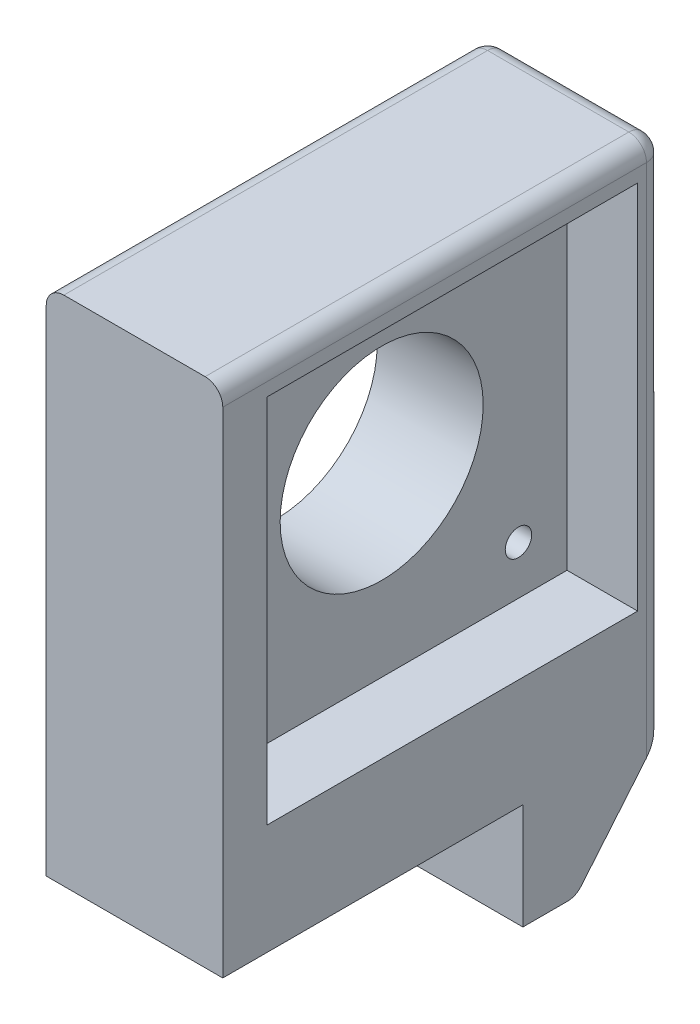
from build123d import *

# Parameters (mm, degrees)
SKETCH1_W           = 20
SKETCH1_H           = 50
BOSS_EXTRUDE1_DEPTH = 70
SKETCH2_R           = 1.5
SKETCH2_R_2         = 11.5
CUT_EXTRUDE2_DEPTH  = 60
SKETCH4_W           = 34
SKETCH4_H           = 12
CUT_EXTRUDE3_DEPTH  = 60
SKETCH8_R           = 2
CUT_EXTRUDE5_DEPTH  = 15
SKETCH9_W           = 42
SKETCH9_H           = 42
CUT_EXTRUDE6_DEPTH  = 8
CUT_EXTRUDE8_DEPTH  = 30
SKETCH17_R          = 3.5
CUT_EXTRUDE13_DEPTH = 9.18109305
SKETCH18_R          = 1.5
CUT_EXTRUDE14_DEPTH = 7
FILLET1_R           = 2
FILLET2_R           = 2
FILLET3_R           = 2
FILLET4_R           = 2


with BuildPart() as part:
    # Sketch1 → Boss-Extrude1 (new body)
    with BuildSketch(Plane(origin=(0, 0, 0), x_dir=(1, 0, 0), z_dir=(0, 1, 0))):
        with Locations((-10, -25)):
            Rectangle(SKETCH1_W, SKETCH1_H)
    extrude(amount=BOSS_EXTRUDE1_DEPTH)

    # Sketch2 → Cut-Extrude2 (cut)
    with BuildSketch(Plane(origin=(0, 0, 0), x_dir=(0, 0, -1), z_dir=(1, 0, 0))):
        with Locations((-8.5, 61)):
            Circle(SKETCH2_R)
        with Locations((-24, 45.5)):
            Circle(SKETCH2_R_2)
        with Locations((-8.5, 30)):
            Circle(SKETCH2_R)
        with Locations((-39.5, 30)):
            Circle(SKETCH2_R)
        with Locations((-39.5, 61)):
            Circle(SKETCH2_R)
    extrude(amount=-CUT_EXTRUDE2_DEPTH, mode=Mode.SUBTRACT)

    # Sketch4 → Cut-Extrude3 (cut)
    with BuildSketch(Plane(origin=(0, 0, 0), x_dir=(0, 0, -1), z_dir=(1, 0, 0))):
        with Locations((-33, 6)):
            Rectangle(SKETCH4_W, SKETCH4_H)
    extrude(amount=-CUT_EXTRUDE3_DEPTH, mode=Mode.SUBTRACT)

    # Sketch8 → Cut-Extrude5 (cut)
    with BuildSketch(Plane(origin=(0, 0, 0), x_dir=(-1, 0, 0), z_dir=(0, 0, -1))):
        with Locations((15, 6)):
            Circle(SKETCH8_R)
        with Locations((5, 6)):
            Circle(SKETCH8_R)
    extrude(amount=-CUT_EXTRUDE5_DEPTH, mode=Mode.SUBTRACT)

    # Sketch9 → Cut-Extrude6 (cut)
    with BuildSketch(Plane(origin=(0, 0, 0), x_dir=(0, 0, -1), z_dir=(1, 0, 0))):
        with Locations((-24, 45.5)):
            Rectangle(SKETCH9_W, SKETCH9_H)
    extrude(amount=-CUT_EXTRUDE6_DEPTH, mode=Mode.SUBTRACT)

    # Sketch11 → Cut-Extrude8 (cut)
    with BuildSketch(Plane(origin=(0, 0, 0), x_dir=(0, 0, -1), z_dir=(1, 0, 0))):
        Polygon((-10, 0), (0, 0), (0, 12), align=None)
    extrude(amount=-CUT_EXTRUDE8_DEPTH, mode=Mode.SUBTRACT)

    # Sketch17 → Cut-Extrude13 (cut)
    with BuildSketch(Plane(origin=(0, 0, 0), x_dir=(-1, 0, 0), z_dir=(0, 0, -1))):
        with Locations((15, 6)):
            Circle(SKETCH17_R)
        with Locations((5, 6)):
            Circle(SKETCH17_R)
    extrude(amount=-CUT_EXTRUDE13_DEPTH, mode=Mode.SUBTRACT)

    # Sketch18 → Cut-Extrude14 (cut)
    with BuildSketch(Plane.ZY.offset(20)):
        with Locations((46, 20)):
            Circle(SKETCH18_R)
        with Locations((39, 20)):
            Circle(SKETCH18_R)
    extrude(amount=-CUT_EXTRUDE14_DEPTH, mode=Mode.SUBTRACT)

    # Fillet1
    fillet1_edges = [part.edges().sort_by_distance(p)[0] for p in [
        (-20, 41, 0),
    ]]
    fillet(fillet1_edges, radius=FILLET1_R)

    # Fillet2
    fillet2_edges = [part.edges().sort_by_distance(p)[0] for p in [
        (-9, 70, 0),
        (-19.414213562, 70, 0.585786438),
        (-20, 70, 26),
    ]]
    fillet(fillet2_edges, radius=FILLET2_R)

    # Fillet3
    fillet3_edges = [part.edges().sort_by_distance(p)[0] for p in [
        (0, 40, 0),
        (0, 69.414213562, 0.585786438),
        (0, 70, 26),
    ]]
    fillet(fillet3_edges, radius=FILLET3_R)

    # Fillet4
    fillet4_edges = [part.edges().sort_by_distance(p)[0] for p in [
        (-10, 0, 10),
    ]]
    fillet(fillet4_edges, radius=FILLET4_R)


solid = part.part
